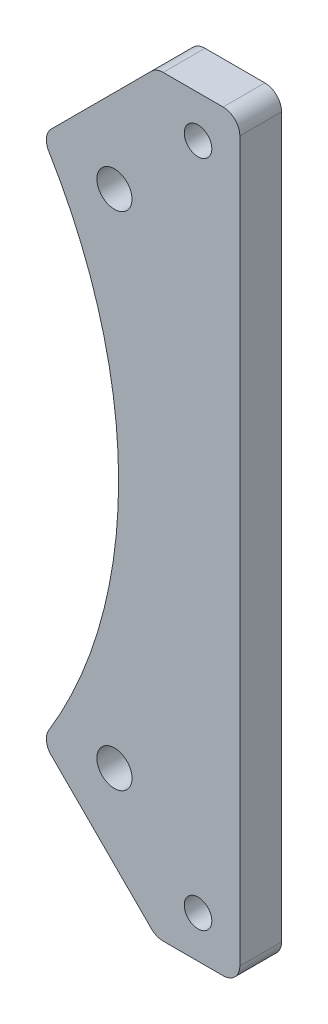
from build123d import *

# Parameters (mm, degrees)
SKETCH_1_R      = 1.65
SKETCH_1_R_2    = 2.1
EXTRUDE_1_DEPTH = 5
FILLET_1_R      = 2


with BuildPart() as part:
    # ｽｹｯﾁ1 → ﾎﾞｽ - 押し出し1 (new body)
    with BuildSketch(Plane.XY):
        with BuildLine():
            Line((72.5, -45), (72.5, 45))
            Line((72.5, 45), (62.5, 45))
            Line((62.5, 45), (48.817911101, 31.317911101))
            ThreePointArc((48.817911101, 31.317911101), (55.657159665, 16.318105836), (58, 0))
            ThreePointArc((58, 0), (55.657159665, -16.318105836), (48.817911101, -31.317911101))
            Line((48.817911101, -31.317911101), (62.5, -45))
            Line((62.5, -45), (72.5, -45))
        make_face()
        with Locations((67.5, -40)):
            Circle(SKETCH_1_R, mode=Mode.SUBTRACT)
        with Locations((57.5, -30)):
            Circle(SKETCH_1_R_2, mode=Mode.SUBTRACT)
        with Locations((57.5, 30)):
            Circle(SKETCH_1_R_2, mode=Mode.SUBTRACT)
        with Locations((67.5, 40)):
            Circle(SKETCH_1_R, mode=Mode.SUBTRACT)
    extrude(amount=EXTRUDE_1_DEPTH)

    # ﾌｨﾚｯﾄ1
    fillet_1_edges = [part.edges().sort_by_distance(p)[0] for p in [
        (62.5, 45, 2.5),
        (48.817911101, 31.317911101, 2.5),
        (48.817911101, -31.317911101, 2.5),
        (62.5, -45, 2.5),
        (72.5, -45, 2.5),
        (72.5, 45, 2.5),
    ]]
    fillet(fillet_1_edges, radius=FILLET_1_R)


solid = part.part
